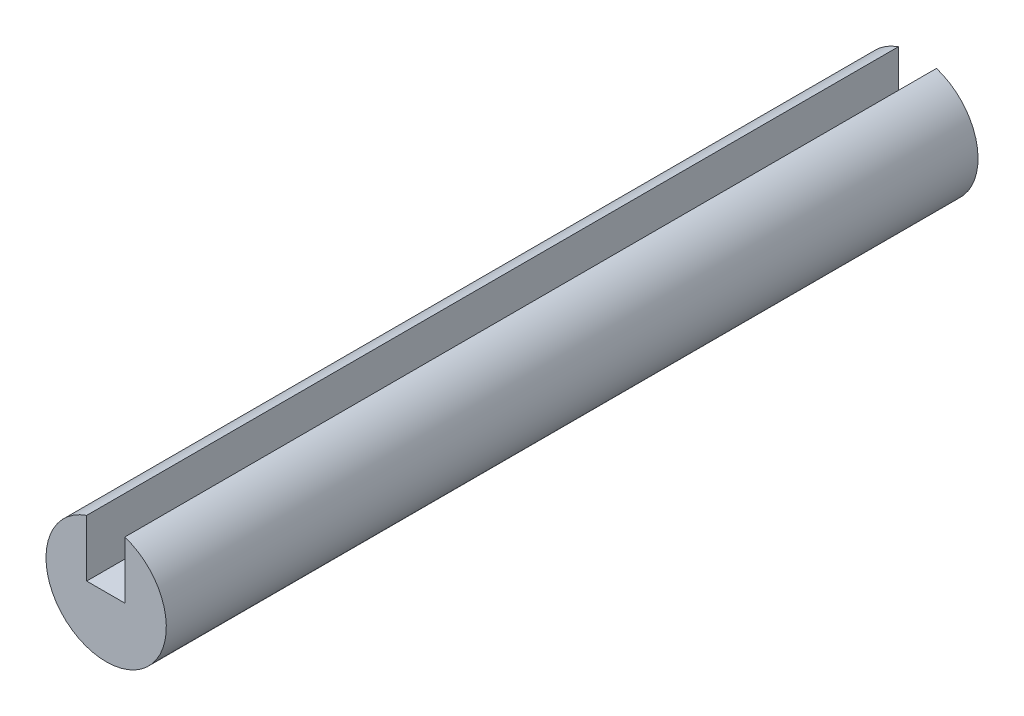
from build123d import *

# Parameters (mm, degrees)
BOSS_EXTRUDE1_DEPTH      = 80
BOSS_EXTRUDE1_DEPTH_BACK = 5
SKETCH1_R                = 6.3
CUT_EXTRUDE2_DEPTH       = 85


with BuildPart() as part:
    # Sketch1 → Boss-Extrude1 (new, two sides: drawn at the far end of the back side and taken through both)
    with BuildSketch(Plane.XY.offset(-BOSS_EXTRUDE1_DEPTH_BACK)):
        Circle(SKETCH1_R)
    extrude(amount=BOSS_EXTRUDE1_DEPTH + BOSS_EXTRUDE1_DEPTH_BACK)

    # Sketch2 → Cut-Extrude2 (cut)
    with BuildSketch(Plane.XY.offset(80)):
        Polygon((0, 0), (1.950143724, 0), (1.950143724, 10.004054158), (-2.03949083, 10.004054158), (-2.03949083, 0), align=None)
    extrude(amount=-CUT_EXTRUDE2_DEPTH, mode=Mode.SUBTRACT)


solid = part.part
